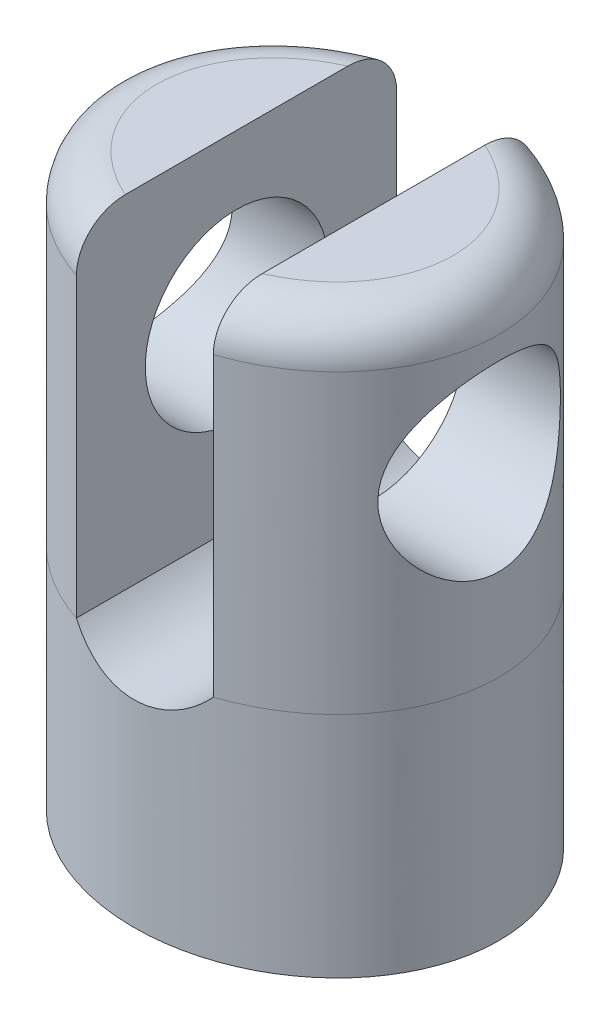
from build123d import *

# Parameters (mm, degrees)
BOSS_EXTRUDE1_START          = -10
BOSS_EXTRUDE1_DEPTH          = 8.645751268
BOSS_EXTRUDE1_2_DEPTH        = 25
BOSS_EXTRUDE1_START_2        = 8.645751268
BOSS_EXTRUDE1_3_DEPTH        = 1.354248732
BOSS_EXTRUDE1_START_3        = -9
BOSS_EXTRUDE1_4_DEPTH        = 18
BOSS_EXTRUDE2_DEPTH          = 15
SKETCH3_RX                   = 8
SKETCH3_RY                   = 6.5
CUT_EXTRUDE1_DEPTH           = 5
F_8_0_8_DIAMETER_HOLE1_D     = 8
F_8_0_8_DIAMETER_HOLE1_DEPTH = 5.5
F_8_0_8_DIAMETER_HOLE2_D     = 8
FILLET1_R                    = 2


with BuildPart() as part:
    # Boss-Extrude1: read off the stored shape, not the designer's step
    # Boss-Extrude1 outline → Boss-Extrude1 (new body)
    with BuildSketch(Plane(origin=(0, 10, 0), x_dir=(-1, 0, 0), z_dir=(0, 1, 0)).offset(BOSS_EXTRUDE1_START)):
        with BuildLine():
            add(Edge.make_bspline(
                [(3, -7.017341347), (8.5, -5.186730561), (8.5, 0)],
                knots=[5.087938965, 5.087938965, 5.087938965, 6.283185307, 6.283185307, 6.283185307], degree=2, weights=[0.754996806, 0.714655955, 1]))
            add(Edge.make_bspline(
                [(8.5, 0), (8.5, 5.186730561), (3, 7.017341347)],
                knots=[0, 0, 0, 1.195246342, 1.195246342, 1.195246342], degree=2, weights=[1, 0.714655955, 0.754996806]))
            Line((3, 7.017341347), (3, -7.017341347))
        make_face()
        with BuildLine():
            Line((3, -7.017341347), (3, 7.017341347))
            add(Edge.make_bspline(
                [(3, 7.017341347), (-0.765077133, 8.270503313), (-4.25, 6.495190528), (-17, 0), (-4.25, -6.495190528), (-0.765077133, -8.270503313), (3, -7.017341347)],
                knots=[1.195246342, 1.195246342, 1.195246342, 2.094395102, 2.094395102, 4.188790205, 4.188790205, 5.087938965, 5.087938965, 5.087938965], degree=2, weights=[0.754996806, 0.785344045, 1, 0.5, 1, 0.785344045, 0.754996806]))
        make_face()
    extrude(amount=BOSS_EXTRUDE1_DEPTH)

    # Boss-Extrude1 2 outline → Boss-Extrude1 2 (add)
    with BuildSketch(Plane(origin=(0, 10, 0), x_dir=(-1, 0, 0), z_dir=(0, 1, 0)).offset(BOSS_EXTRUDE1_START)):
        with BuildLine():
            add(Edge.make_bspline(
                [(3, -7.017341347), (5.082450002, -6.324222177), (7.002616192, -4.991336942), (8.083656457, -3.185300612), (8.5, -1.482691152), (8.5, 1.482691152), (8.083656457, 3.185300612), (7.002616192, 4.991336942), (5.082450002, 6.324222177), (3, 7.017341347)],
                knots=[5.087938965, 5.087938965, 5.087938965, 5.087938965, 5.087938965, 5.087938965, 6.283185307, 6.283185307, 6.283185307, 6.283185307, 7.478431649, 7.478431649, 7.478431649, 7.478431649, 7.478431649, 7.478431649], degree=5, weights=[1, 1, 0.990208355, 0.99736924, 1, 1, 0.99736924, 0.990208355, 1, 1]))
            Line((3, 7.017341347), (3, -7.017341347))
        make_face()
    extrude(amount=BOSS_EXTRUDE1_2_DEPTH)

    # Boss-Extrude1 3 outline → Boss-Extrude1 3 (add)
    with BuildSketch(Plane(origin=(0, 0, 0), x_dir=(1, 0, 0), z_dir=(0, 1, 0)).offset(BOSS_EXTRUDE1_START_2)):
        with BuildLine():
            add(Edge.make_bspline(
                [(-8.5, 0), (-8.5, -12.990381057), (4.25, -6.495190528), (17, 0), (4.25, 6.495190528), (-8.5, 12.990381057), (-8.5, 0)],
                knots=[0, 0, 0, 2.094395102, 2.094395102, 4.188790205, 4.188790205, 6.283185307, 6.283185307, 6.283185307], degree=2, weights=[1, 0.5, 1, 0.5, 1, 0.5, 1]))
        make_face()
    extrude(amount=BOSS_EXTRUDE1_3_DEPTH)

    # Boss-Extrude1 4 outline → Boss-Extrude1 4 (cut)
    with BuildSketch(Plane.XY.offset(BOSS_EXTRUDE1_START_3)):
        with BuildLine():
            ThreePointArc((-3, 10), (0, 8.645751311), (3, 10))
            Line((3, 10), (-3, 10))
        make_face()
    extrude(amount=BOSS_EXTRUDE1_4_DEPTH, mode=Mode.SUBTRACT)

    # Sketch2 → Boss-Extrude2 (add)
    with BuildSketch(Plane(origin=(0, 10, 0), x_dir=(-1, 0, 0), z_dir=(0, 1, 0))):
        with BuildLine():
            Line((-3, 7.017341347), (-3, -7.017341347))
            add(Edge.make_bspline(
                [(-3, 7.017341347), (-24.083333333, 0), (-3, -7.017341347)],
                knots=[5.073101701, 5.073101701, 5.073101701, 7.493268914, 7.493268914, 7.493268914], degree=2, weights=[1, 0.352941176, 1]))
        make_face()
    extrude(amount=BOSS_EXTRUDE2_DEPTH)

    # Sketch3 → Cut-Extrude1 (cut)
    with BuildSketch(Plane.XZ):
        with Locations(Location((0, 0), (0, 0, 0))):
            Ellipse(SKETCH3_RX, SKETCH3_RY)
    extrude(amount=-CUT_EXTRUDE1_DEPTH, mode=Mode.SUBTRACT)

    # Ø8.0 (8) Diameter Hole1
    with Locations(Plane(origin=(-3, 0, 0), x_dir=(0, 0, -1), z_dir=(1, 0, 0))):
        with Locations((0, 18)):
            Hole(F_8_0_8_DIAMETER_HOLE1_D / 2, depth=F_8_0_8_DIAMETER_HOLE1_DEPTH)

    # Ø8.0 (8) Diameter Hole2 (through all)
    with Locations(Plane.ZY.offset(-3)):
        with Locations((0, 18)):
            Hole(F_8_0_8_DIAMETER_HOLE2_D / 2)

    # Fillet1
    fillet1_edges = [part.edges().sort_by_distance(p)[0] for p in [
        (-8.5, 25, 0),
        (8.49999995, 25, 0.000816296),
    ]]
    fillet(fillet1_edges, radius=FILLET1_R)


solid = part.part
